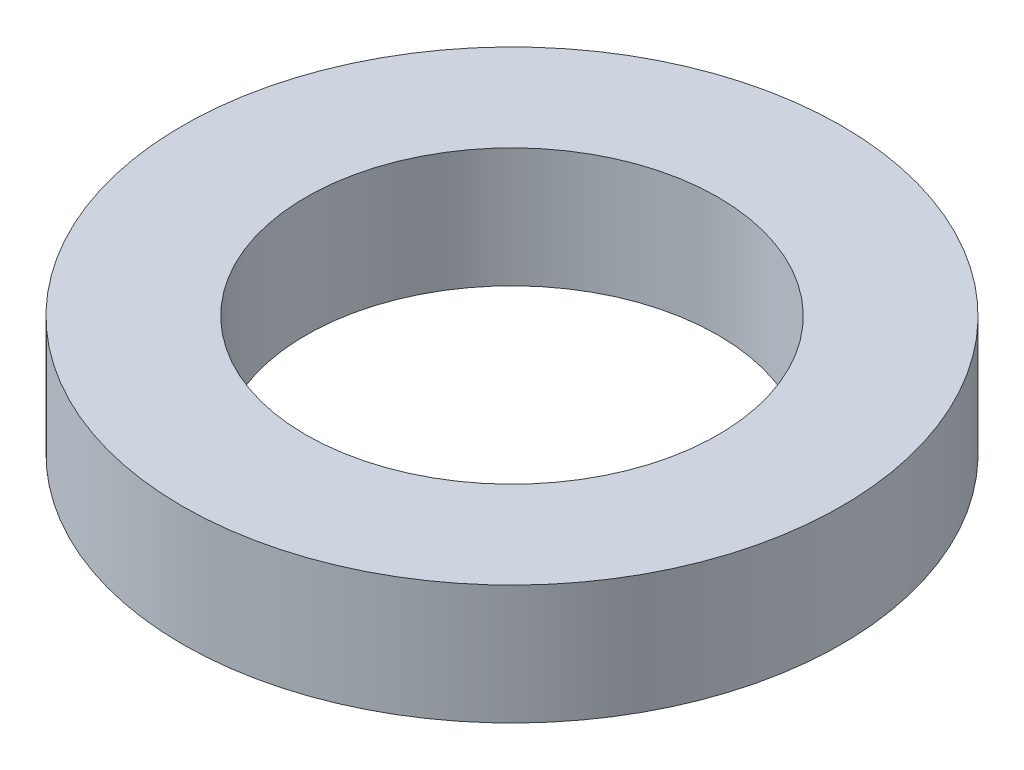
from build123d import *

# Parameters (mm, degrees)
SKETCH1_R           = 80
BOSS_EXTRUDE1_DEPTH = 29
SKETCH2_R           = 50
CUT_EXTRUDE1_DEPTH  = 117.79469166


with BuildPart() as part:
    # Sketch1 → Boss-Extrude1 (new body)
    with BuildSketch(Plane(origin=(0, 0, 0), x_dir=(1, 0, 0), z_dir=(0, 1, 0))):
        Circle(SKETCH1_R)
    extrude(amount=BOSS_EXTRUDE1_DEPTH)

    # Sketch2 → Cut-Extrude1 (cut, through all)
    with BuildSketch(Plane(origin=(0, 0, 0), x_dir=(1, 0, 0), z_dir=(0, 1, 0))):
        Circle(SKETCH2_R)
    extrude(amount=CUT_EXTRUDE1_DEPTH, mode=Mode.SUBTRACT)


solid = part.part
